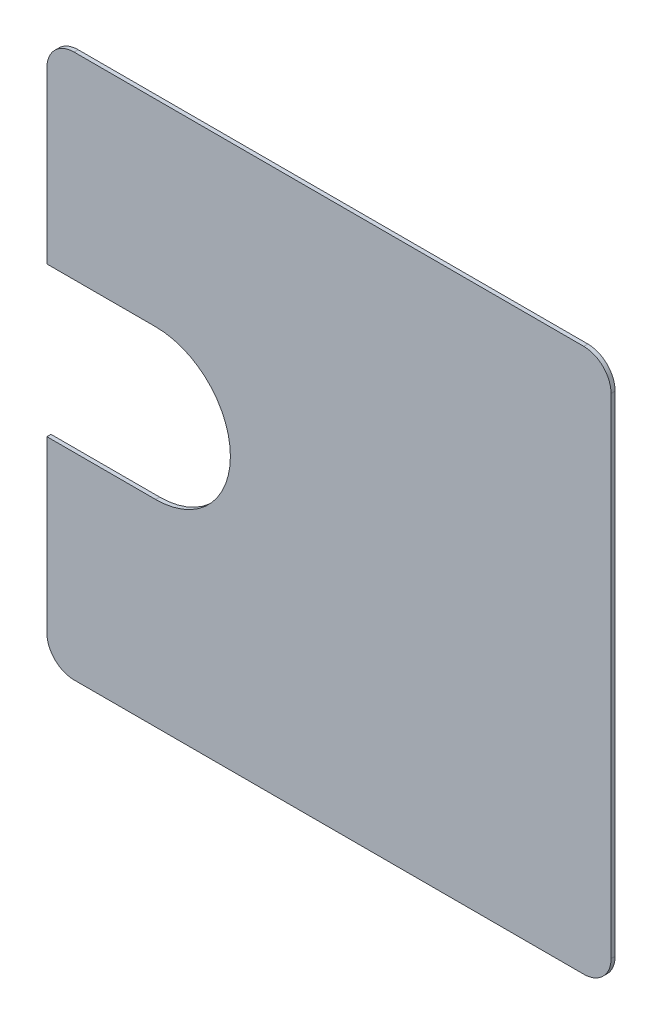
from build123d import *

# Parameters (mm, degrees)
EXTRUDE_1_DEPTH = 3


with BuildPart() as part:
    # 草图1 → 凸台-拉伸1 (new body)
    with BuildSketch(Plane.XY):
        with BuildLine():
            Line((-127.5, 55), (-207.5, 55))
            Line((-207.5, 55), (-207.5, 180))
            ThreePointArc((-207.5, 180), (-201.642135624, 194.142135624), (-187.5, 200))
            Line((-187.5, 200), (187.5, 200))
            ThreePointArc((187.5, 200), (201.642135624, 194.142135624), (207.5, 180))
            Line((207.5, 180), (207.5, -180))
            ThreePointArc((207.5, -180), (201.642135624, -194.142135624), (187.5, -200))
            Line((187.5, -200), (-187.5, -200))
            ThreePointArc((-187.5, -200), (-201.642135624, -194.142135624), (-207.5, -180))
            Line((-207.5, -180), (-207.5, -55))
            Line((-207.5, -55), (-127.5, -55))
            ThreePointArc((-127.5, -55), (-72.5, 0), (-127.5, 55))
        make_face()
    extrude(amount=EXTRUDE_1_DEPTH)


solid = part.part
